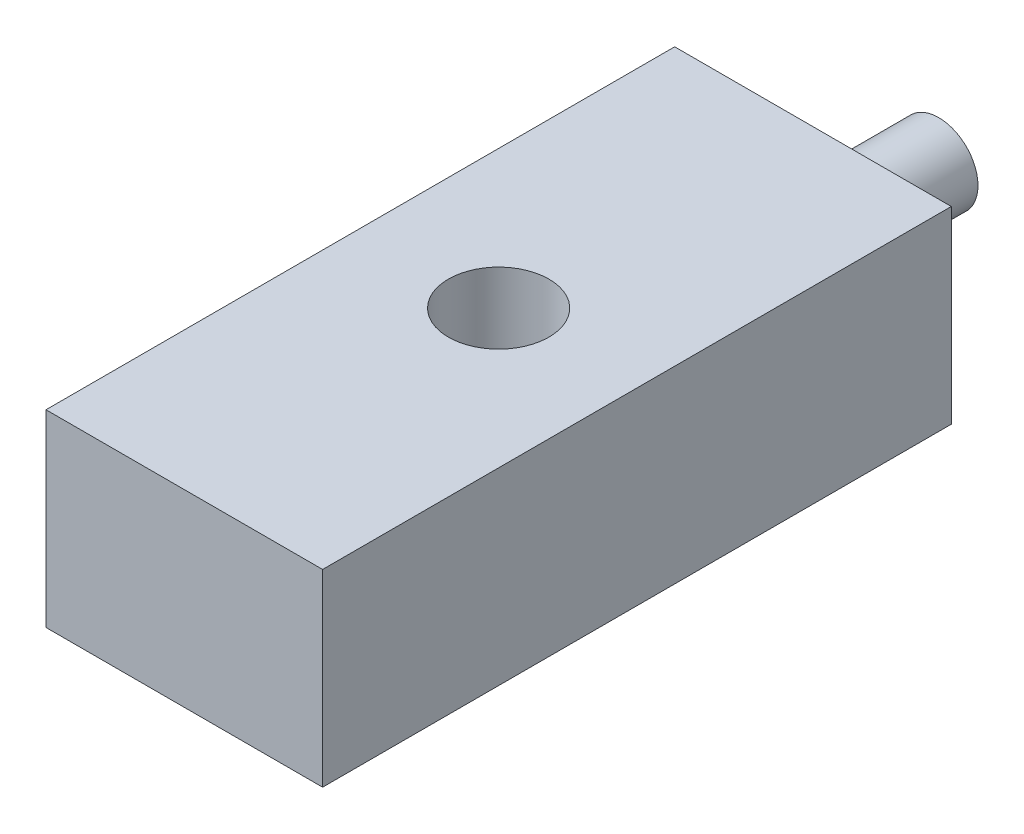
from build123d import *

# Parameters (mm, degrees)
CROQUIS1_R              = 3.125
CROQUIS1_R_2            = 2.7
SALIENTE_EXTRUIR1_DEPTH = 10
CROQUIS2_W              = 22
CROQUIS2_H              = 15
SALIENTE_EXTRUIR2_DEPTH = 50
CROQUIS3_R              = 4
CORTAR_EXTRUIR1_DEPTH   = 63.841873384


with BuildPart() as part:
    # Croquis1 → Saliente-Extruir1 (new body)
    with BuildSketch(Plane.XY):
        with Locations((0.140065102, 8.039289834)):
            Circle(CROQUIS1_R)
        with Locations((0.140065102, 8.039289834)):
            Circle(CROQUIS1_R_2, mode=Mode.SUBTRACT)
    extrude(amount=SALIENTE_EXTRUIR1_DEPTH)

    # Croquis2 → Saliente-Extruir2 (add)
    with BuildSketch(Plane.XY.offset(10)):
        with Locations((0.140065102, 8.039289834)):
            Rectangle(CROQUIS2_W, CROQUIS2_H)
    extrude(amount=SALIENTE_EXTRUIR2_DEPTH)

    # Croquis3 → Cortar-Extruir1 (cut, through all)
    with BuildSketch(Plane.XZ.offset(-0.539289834)):
        with Locations((0.140065102, 35)):
            Circle(CROQUIS3_R)
    extrude(amount=-CORTAR_EXTRUIR1_DEPTH, mode=Mode.SUBTRACT)


solid = part.part
